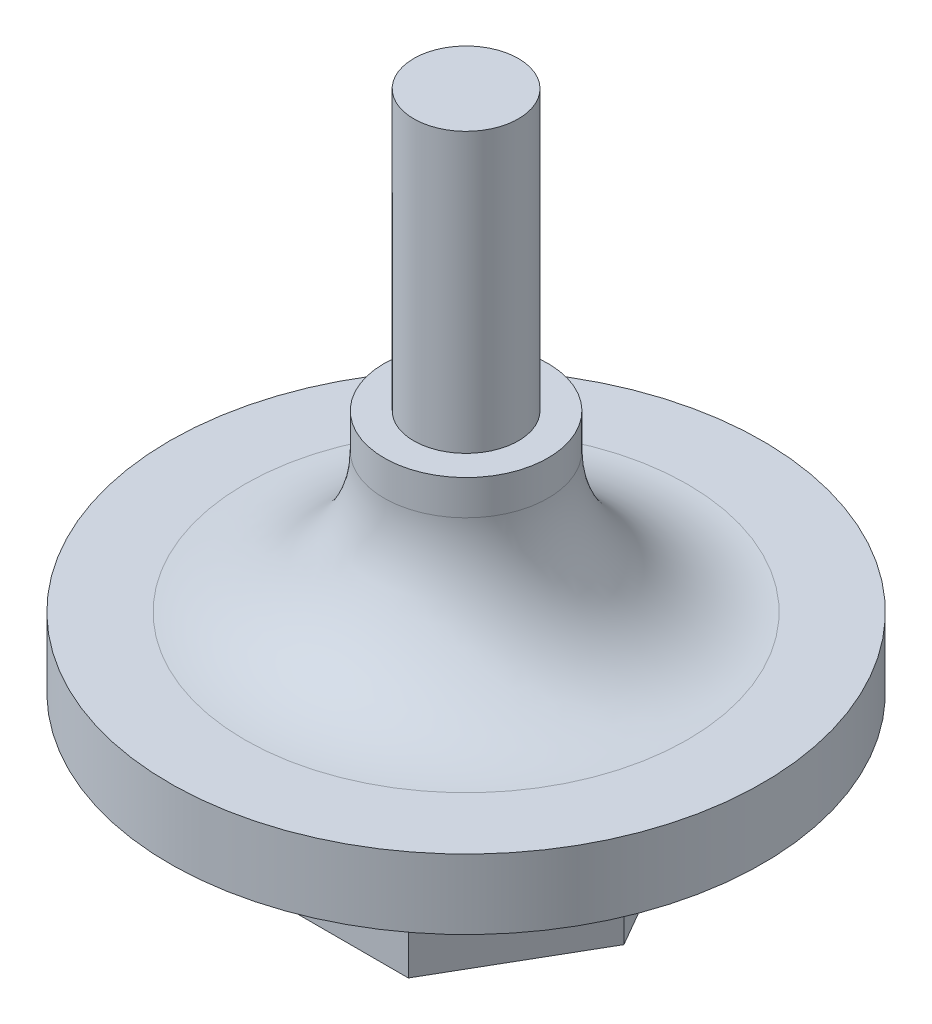
from build123d import *

# Parameters (mm, degrees)
BOSS_EXTRUDE1_DEPTH = 6.35


with BuildPart() as part:
    # Sketch1 → Revolve1 (revolve)
    with BuildSketch(Plane.XY):
        with BuildLine():
            Line((0, 0), (13.5, 0))
            Line((13.5, 0), (13.5, 3.175))
            Line((13.5, 3.175), (10.08, 3.175))
            ThreePointArc((10.08, 3.175), (5.589871939, 5.034871939), (3.73, 9.525))
            Line((3.73, 9.525), (3.73, 11.1125))
            Line((3.73, 11.1125), (2.38125, 11.1125))
            Line((2.38125, 11.1125), (2.38125, 23.8125))
            Line((2.38125, 23.8125), (0, 23.8125))
            Line((0, 23.8125), (0, 0))
        make_face()
    revolve(axis=Axis((0, 23.8125, 0), (0, -1, 0)))

    # Sketch2 → Boss-Extrude1 (add)
    with BuildSketch(Plane.XZ):
        Polygon((7.18570145, 0), (3.592850725, 6.223), (-3.592850725, 6.223), (-7.18570145, 0), (-3.592850725, -6.223), (3.592850725, -6.223), align=None)
    extrude(amount=BOSS_EXTRUDE1_DEPTH)


solid = part.part
